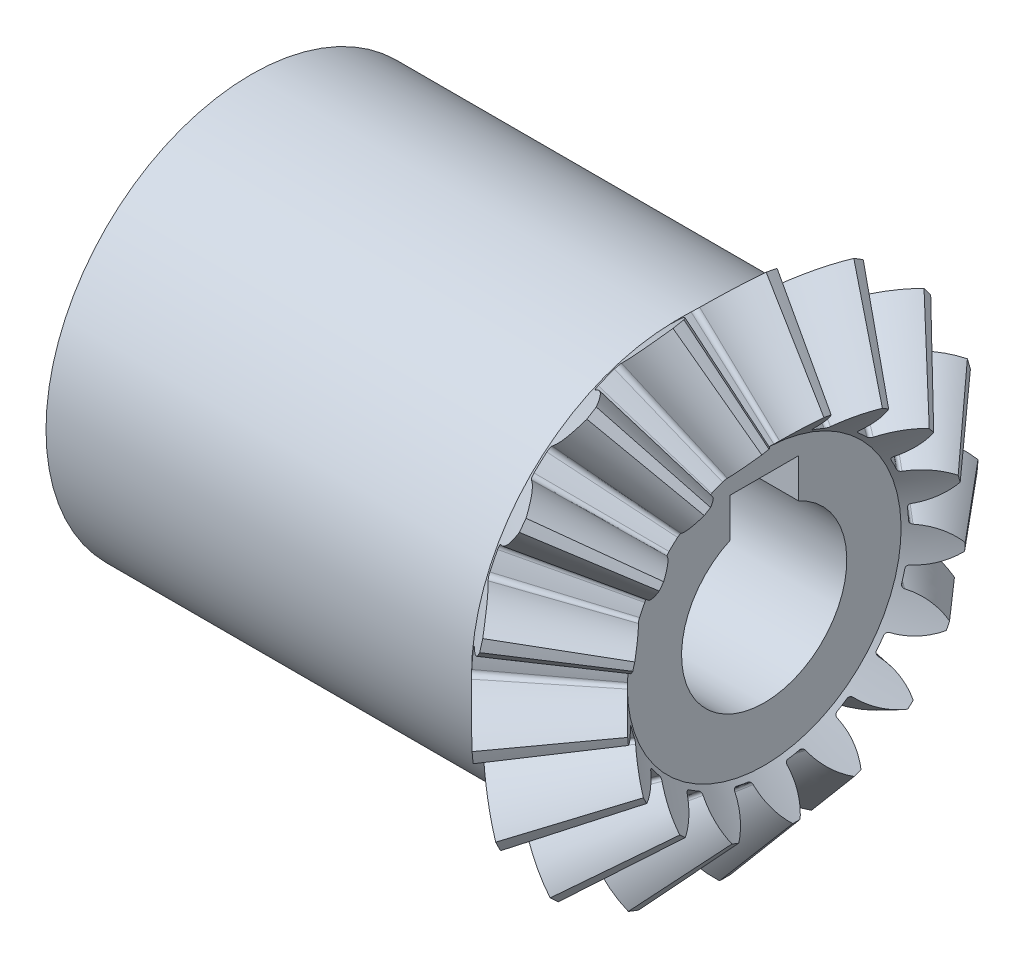
from build123d import *

# Parameters (mm, degrees)
TEETHCUTS_COUNT = 17
TEETHCUTS_ANGLE = 338.823529412
HUBSKE_R        = 14.899008976
HUB_DEPTH       = 30.899110576
BORSKE_R        = 6
BORE_DEPTH      = 50.0000508
KEYSKE_W        = 5
KEYSKE_H        = 8.3
KEYWAY_DEPTH    = 50.0000508


with BuildPart() as part:
    # BasProSke → Base-Revolve (revolve)
    with BuildSketch(Plane(origin=(0, 0, 0), x_dir=(1, 0, 0), z_dir=(0, 1, 0)), mode=Mode.PRIVATE) as base_revolve_sk:
        Polygon((0, 0), (0, 14.899008978), (3.515204589, 18.414213561), (8.701470597, 12.286771071), (6.355971893, 9.941272371), (6.355971893, 0), align=None)
    revolve(base_revolve_sk.sketch.rotate(Axis((-10, 0, 0), (1, 0, 0)), 180), axis=Axis((-10, 0, 0), (1, 0, 0)))

    # ToothCut: read off the stored shape, not the designer's step
    # ToothCut: loft between two sections, ruled curve by curve
    toothcut_from = [
        Edge.make_bspline([(19.106858394, 0.005867368, -0.009614449), (19.102695696, 0.00170467, -0.014695165), (19.097225397, -0.003765628, -0.013906837), (19.093872922, -0.007118103, -0.007743103)], [0, 0, 0, 0, 1, 1, 1, 1], 3, [1, 0.791271361, 0.791271361, 1]),
        Edge.make_bspline([(19.093872922, -0.007118103, 0.007743103), (19.097225397, -0.003765628, 0.013906837), (19.102695696, 0.00170467, 0.014695165), (19.106858394, 0.005867368, 0.009614449)], [0, 0, 0, 0, 1, 1, 1, 1], 3, [1, 0.791271361, 0.791271361, 1]),
        Edge.make_bspline([(19.093872922, -0.007118103, -0.007743103), (19.093341275, -0.007649751, -0.006765636), (19.092915182, -0.008075843, -0.005689705), (19.092603604, -0.008387421, -0.004537933)], [0, 0, 0, 0, 1, 1, 1, 1], 3, [1, 0.992990487, 0.992990487, 1]),
        Edge.make_bspline([(19.092603604, -0.008387421, 0.004537933), (19.092915182, -0.008075843, 0.005689705), (19.093341275, -0.007649751, 0.006765636), (19.093872922, -0.007118103, 0.007743103)], [0, 0, 0, 0, 1, 1, 1, 1], 3, [1, 0.992990487, 0.992990487, 1]),
        Edge.make_bspline([(19.092603604, -0.008387421, -0.004537933), (19.09180404, -0.009186986, -0.001582283), (19.09180404, -0.009186986, 0.001582283), (19.092603604, -0.008387421, 0.004537933)], [0, 0, 0, 0, 1, 1, 1, 1], 3, [1, 0.955988633, 0.955988633, 1]),
        Edge.make_line((19.106858394, 0.005867368, 0.009614449), (19.106858394, 0.005867368, -0.009614449)),
    ]
    toothcut_to = [
        Edge.make_bspline([(3.585040898, 18.48404987, -3.289625278), (2.819195002, 17.718203976, -2.044291585), (1.794287219, 16.693296194, -1.254972922), (0.639066476, 15.538075453, -1.020823505)], [0, 0, 0, 0, 1, 1, 1, 1], 3, [1, 0.958126663, 0.958126663, 1]),
        Edge.make_bspline([(0.639066476, 15.538075453, 1.020823505), (1.794287219, 16.693296194, 1.254972922), (2.819195002, 17.718203976, 2.044291585), (3.585040898, 18.48404987, 3.289625278)], [0, 0, 0, 0, 1, 1, 1, 1], 3, [1, 0.958126663, 0.958126663, 1]),
        Edge.make_bspline([(0.639066476, 15.538075453, -1.020823505), (0.496378486, 15.395387463, -0.991902358), (0.404332419, 15.303341397, -0.835022783), (0.410556038, 15.309565016, -0.631359603)], [0, 0, 0, 0, 1, 1, 1, 1], 3, [1, 0.827522008, 0.827522008, 1]),
        Edge.make_bspline([(0.410556038, 15.309565016, 0.631359603), (0.404332419, 15.303341397, 0.835022783), (0.496378486, 15.395387463, 0.991902358), (0.639066476, 15.538075453, 1.020823505)], [0, 0, 0, 0, 1, 1, 1, 1], 3, [1, 0.827522008, 0.827522008, 1]),
        Edge.make_bspline([(0.410556038, 15.309565016, -0.631359603), (0.42341426, 15.322423238, -0.210584115), (0.42341426, 15.322423238, 0.210584115), (0.410556038, 15.309565016, 0.631359603)], [0, 0, 0, 0, 1, 1, 1, 1], 3, [1, 0.999378327, 0.999378327, 1]),
        Edge.make_line((3.585040898, 18.48404987, 3.289625278), (3.585040898, 18.48404987, -3.289625278)),
    ]
    toothcut = Solid(Shell([*[Face.make_surface_from_curves(toothcut_from[k], toothcut_to[k]) for k in range(6)], Face(Wire(toothcut_from)), Face(Wire(toothcut_to))]))
    add(toothcut, mode=Mode.SUBTRACT)

    # TeethCuts: ToothCut ×17 about axis
    teethcuts_axis = Axis((-10, 0, 0), (1, 0, 0))
    for i in range(1, TEETHCUTS_COUNT):
        add(toothcut.rotate(teethcuts_axis, i * TEETHCUTS_ANGLE / (TEETHCUTS_COUNT - 1)), mode=Mode.SUBTRACT)

    # HubSke → Hub (add)
    with BuildSketch(Plane.ZY):
        Circle(HUBSKE_R)
    extrude(amount=HUB_DEPTH)

    # BorSke → Bore (cut, symmetric)
    with BuildSketch(Plane(origin=(0, 0, 0), x_dir=(0, 0, -1), z_dir=(1, 0, 0))):
        with Locations(Location((0, 0, 0), (0, 0, 180))):
            Circle(BORSKE_R)
    extrude(amount=BORE_DEPTH, both=True, mode=Mode.SUBTRACT)

    # KeySke → Keyway (cut, symmetric)
    with BuildSketch(Plane(origin=(0, 0, 0), x_dir=(0, 0, -1), z_dir=(1, 0, 0))):
        with Locations((0, 4.15)):
            Rectangle(KEYSKE_W, KEYSKE_H)
    extrude(amount=KEYWAY_DEPTH, both=True, mode=Mode.SUBTRACT)


solid = part.part
